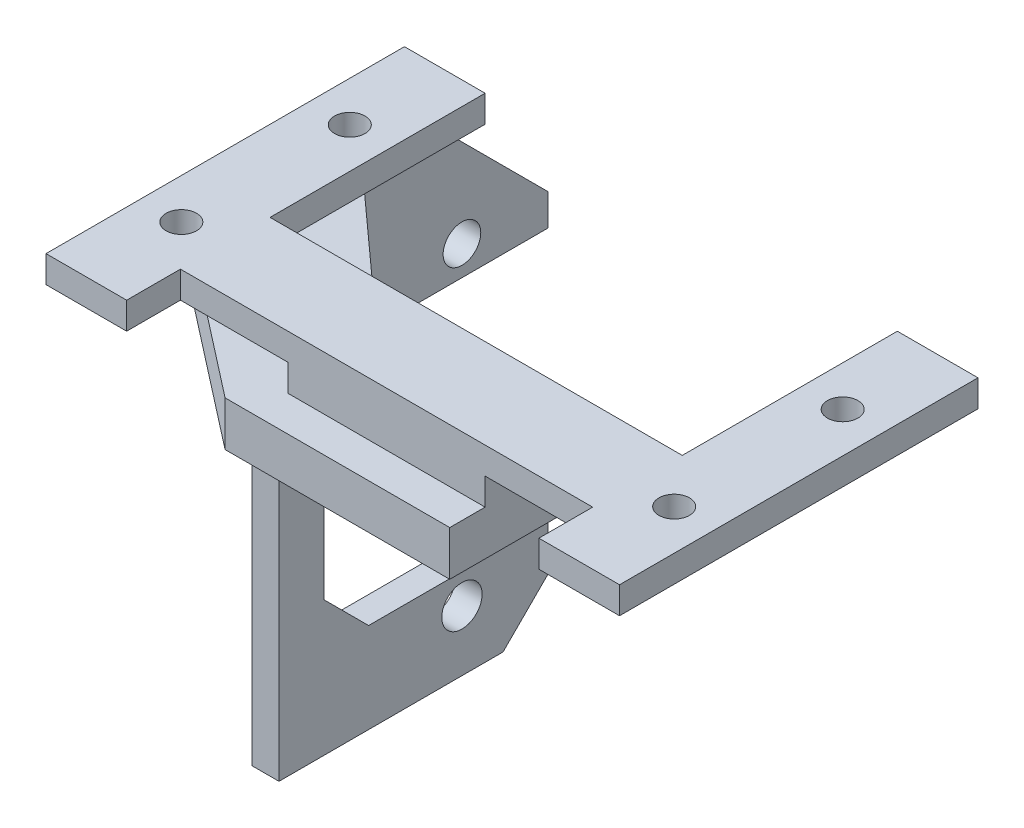
from build123d import *

# Parameters (mm, degrees)
SKETCH_1_W          = 9
SKETCH_1_H          = 40
SKETCH_1_R          = 1.7
EXTRUDE_1_DEPTH     = 3
EXTRUDE_1_2_DEPTH   = 3
SKETCH_2_W          = 46
SKETCH_2_H          = 10
EXTRUDE_2_DEPTH     = 3
SKETCH_3_W          = 22
SKETCH_3_H          = 10
EXTRUDE_3_DEPTH     = 8
EXTRUDE_5_DEPTH     = 5
SKETCH_11_W         = 30
SKETCH_11_H         = 52
EXTRUDE_6_DEPTH     = 3
SKETCH_12_R         = 2.1
SKETCH_12_R_2       = 2.25
CUT_EXTRUDE_3_DEPTH = 13
SKETCH_13_W         = 25
SKETCH_13_H         = 28.4
CUT_EXTRUDE_4_DEPTH = 13
CHAMFER_3_SIZE      = 10
CHAMFER_4_SIZE      = 5
CHAMFER_5_SIZE      = 5
SKETCH_14_W         = 22.803508502
SKETCH_14_H         = 5
EXTRUDE_7_DEPTH     = 5
EXTRUDE_8_REACH     = 78.026
SKETCH_15_W         = 3.946761087
SKETCH_15_H         = 5
CHAMFER_6_SIZE      = 5
EXTRUDE_9_DEPTH     = 5


with BuildPart() as part:
    # 草图1 → 凸台-拉伸1 (new body)
    with BuildSketch(Plane(origin=(0, 0, 0), x_dir=(1, 0, 0), z_dir=(0, 1, 0))):
        with Locations((27.5, 0)):
            Rectangle(SKETCH_1_W, SKETCH_1_H)
        with Locations(Location((27.5, 9.4, 0), (0, 0, 90))):
            Circle(SKETCH_1_R, mode=Mode.SUBTRACT)
        with Locations(Location((27.5, -9.4, 0), (0, 0, 270))):
            Circle(SKETCH_1_R, mode=Mode.SUBTRACT)
    extrude(amount=EXTRUDE_1_DEPTH)



with BuildPart() as body_2:
    # 草图1 → Extrude 1 2 (new body)
    with BuildSketch(Plane(origin=(0, 0, 0), x_dir=(1, 0, 0), z_dir=(0, 1, 0))):
        with Locations((-27.5, 0)):
            Rectangle(SKETCH_1_W, SKETCH_1_H)
        with Locations(Location((-27.5, 9.4, 0), (0, 0, 270))):
            Circle(SKETCH_1_R, mode=Mode.SUBTRACT)
        with Locations(Location((-27.5, -9.4, 0), (0, 0, 90))):
            Circle(SKETCH_1_R, mode=Mode.SUBTRACT)
    extrude(amount=EXTRUDE_1_2_DEPTH)


with BuildPart() as part_1:
    add(part.part)

    add(body_2.part)  # 凸台-拉伸2 merges body 2
    # 草图2 → 凸台-拉伸2 (add)
    with BuildSketch(Plane(origin=(0, 0, 0), x_dir=(-1, 0, 0), z_dir=(0, -1, 0))):
        with Locations((0, -9)):
            Rectangle(SKETCH_2_W, SKETCH_2_H)
    extrude(amount=-EXTRUDE_2_DEPTH)

    # 草图3 → 凸台-拉伸3 (add)
    with BuildSketch(Plane.XZ):
        with Locations((0, 9)):
            Rectangle(SKETCH_3_W, SKETCH_3_H)
    extrude(amount=EXTRUDE_3_DEPTH)

    # 草图10 → 凸台-拉伸5 (add)
    with BuildSketch(Plane.XZ.offset(8)):
        Polygon((-11, 14), (-29, 0), (-29, -12.266402166), (-11, 4), align=None)
    extrude(amount=-EXTRUDE_5_DEPTH)

    # 草图11 → 凸台-拉伸6 (add)
    with BuildSketch(Plane.ZY.offset(29)):
        with Locations((-15, -29)):
            Rectangle(SKETCH_11_W, SKETCH_11_H)
    extrude(amount=-EXTRUDE_6_DEPTH)

    # 草图12 → 切除-拉伸3 (cut)
    with BuildSketch(Plane(origin=(-26, 0, 0), x_dir=(0, 0, -1), z_dir=(1, 0, 0))):
        with Locations((20.414, -13.24)):
            Circle(SKETCH_12_R)
        with Locations((20.414, -48.24)):
            Circle(SKETCH_12_R_2)
    extrude(amount=-CUT_EXTRUDE_3_DEPTH, mode=Mode.SUBTRACT)

    # 草图13 → 切除-拉伸4 (cut)
    with BuildSketch(Plane.ZY.offset(29)):
        with Locations((-17.5, -30.74)):
            Rectangle(SKETCH_13_W, SKETCH_13_H)
    extrude(amount=-CUT_EXTRUDE_4_DEPTH, mode=Mode.SUBTRACT)

    # 倒角3
    chamfer_3_edges = [part_1.edges().sort_by_distance(p)[0] for p in [
        (-27.5, -3, -30),
    ]]
    chamfer(chamfer_3_edges, length=CHAMFER_3_SIZE)

    # 倒角4
    chamfer_4_edges = [part_1.edges().sort_by_distance(p)[0] for p in [
        (-27.5, -55, -30),
    ]]
    chamfer(chamfer_4_edges, length=CHAMFER_4_SIZE)

    # 倒角5
    chamfer_5_edges = [part_1.edges().sort_by_distance(p)[0] for p in [
        (-27.5, -16.54, -5),
        (-27.5, -44.94, -5),
    ]]
    chamfer(chamfer_5_edges, length=CHAMFER_5_SIZE)

    # 草图14 → 凸台-拉伸7 (add)
    with BuildSketch(Plane(origin=(-10.930769231, 0, 14.053846154), x_dir=(0.7893522173763264, 0, 0.6139406135149205), z_dir=(-0.6139406135149205, 0, 0.7893522173763264))):
        with Locations((-11.489460053, -5.5)):
            Rectangle(SKETCH_14_W, SKETCH_14_H)
    extrude(amount=EXTRUDE_7_DEPTH)

    # 凸台-拉伸8: up to this plane
    extrude_8_end = Plane(origin=(-14.000472298, 0, 18.000607241), z_dir=(-0.6139406135149204, 0, 0.7893522173763263))
    # 草图15 → 凸台-拉伸8 (add, up to the surface)
    with BuildSketch(Plane(origin=(11, 0, 0), x_dir=(0, 0, -1), z_dir=(1, 0, 0)), mode=Mode.PRIVATE) as extrude_8_sk1:
        with Locations((-15.973380544, -5.5)):
            Rectangle(SKETCH_15_W, SKETCH_15_H)
    extrude_8_tool1 = split(extrude(extrude_8_sk1.sketch, amount=-EXTRUDE_8_REACH, mode=Mode.PRIVATE), bisect_by=extrude_8_end, keep=Keep.BOTH, mode=Mode.PRIVATE)
    add(extrude_8_tool1.solids().sort_by_distance((11, -5.5, 15.973381))[0])

    # 倒角6
    chamfer_6_edges = [part_1.edges().sort_by_distance(p)[0] for p in [
        (-29, -5.5, 0),
    ]]
    chamfer(chamfer_6_edges, length=CHAMFER_6_SIZE - 0.0001)  # a hair under: the kernel refuses the full size

    # 草图17 → 凸台-拉伸9 (add)
    with BuildSketch(Plane.XZ.offset(8)):
        Polygon((-29, 0), (-20.325921578, 10.286880116), (-17.338272835, 7.767642096), (-26, -4.155710702), align=None)
    extrude(amount=EXTRUDE_9_DEPTH)


solid = part_1.part
